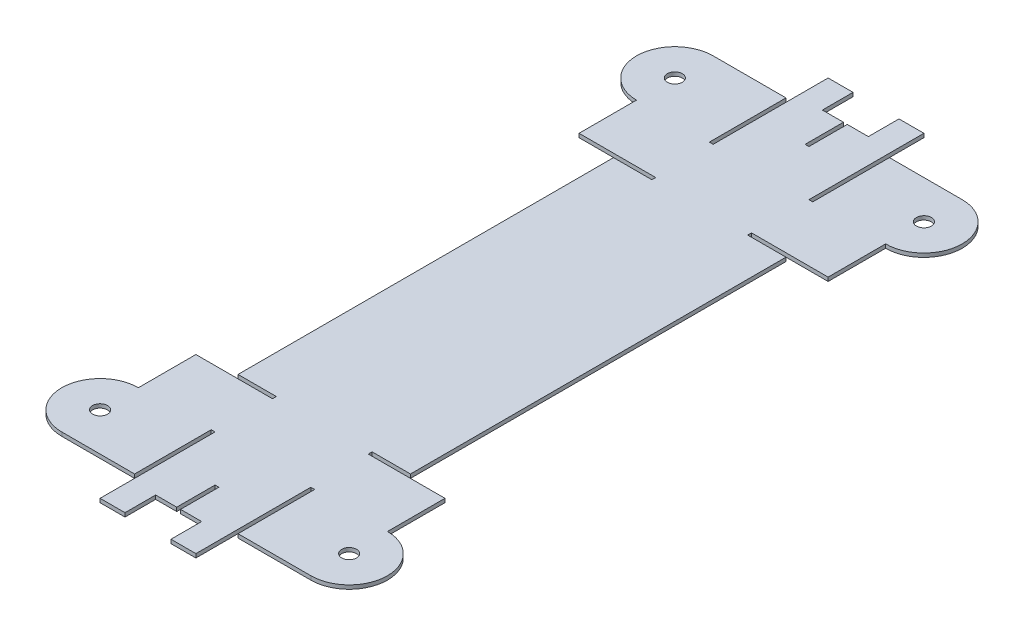
from build123d import *

# Parameters (mm, degrees)
SKETCH1_R           = 1.95
BOSS_EXTRUDE1_DEPTH = 1


with BuildPart() as part:
    # Sketch1 → Boss-Extrude1 (new body)
    with BuildSketch(Plane(origin=(0, 0, 0), x_dir=(1, 0, 0), z_dir=(0, 1, 0))):
        with BuildLine():
            Line((-32.5, 85), (-13.5, 85))
            Line((-13.5, 85), (-13.5, 65))
            Line((-13.5, 65), (-12.5, 65))
            Line((-12.5, 65), (-12.5, 95))
            Line((-12.5, 95), (-6, 95))
            Line((-6, 95), (-6, 87))
            Line((-6, 87), (-0.5, 87))
            Line((-0.5, 87), (-0.5, 77))
            Line((-0.5, 77), (0.5, 77))
            Line((0.5, 77), (0.5, 87))
            Line((0.5, 87), (6, 87))
            Line((6, 87), (6, 95))
            Line((6, 95), (12.5, 95))
            Line((12.5, 95), (12.5, 65))
            Line((12.5, 65), (13.5, 65))
            Line((13.5, 65), (13.5, 85))
            Line((13.5, 85), (32.5, 85))
            ThreePointArc((32.5, 85), (42.5, 75), (32.5, 65))
            Line((32.5, 65), (32.5, 50))
            Line((32.5, 50), (12.5, 50))
            Line((12.5, 50), (12.5, 49))
            Line((12.5, 49), (22.5, 49))
            Line((22.5, 49), (22.5, -49))
            Line((22.5, -49), (12.5, -49))
            Line((12.5, -49), (12.5, -50))
            Line((12.5, -50), (32.5, -50))
            Line((32.5, -50), (32.5, -65))
            ThreePointArc((32.5, -65), (42.5, -75), (32.5, -85))
            Line((32.5, -85), (13.5, -85))
            Line((13.5, -85), (13.5, -65))
            Line((13.5, -65), (12.5, -65))
            Line((12.5, -65), (12.5, -95))
            Line((12.5, -95), (6, -95))
            Line((6, -95), (6, -87))
            Line((6, -87), (0.5, -87))
            Line((0.5, -87), (0.5, -77))
            Line((0.5, -77), (-0.5, -77))
            Line((-0.5, -77), (-0.5, -87))
            Line((-0.5, -87), (-6, -87))
            Line((-6, -87), (-6, -95))
            Line((-6, -95), (-12.5, -95))
            Line((-12.5, -95), (-12.5, -65))
            Line((-12.5, -65), (-13.5, -65))
            Line((-13.5, -65), (-13.5, -85))
            Line((-13.5, -85), (-32.5, -85))
            ThreePointArc((-32.5, -85), (-42.5, -75), (-32.5, -65))
            Line((-32.5, -65), (-32.5, -50))
            Line((-32.5, -50), (-12.5, -50))
            Line((-12.5, -50), (-12.5, -49))
            Line((-12.5, -49), (-22.5, -49))
            Line((-22.5, -49), (-22.5, 49))
            Line((-22.5, 49), (-12.5, 49))
            Line((-12.5, 49), (-12.5, 50))
            Line((-12.5, 50), (-32.5, 50))
            Line((-32.5, 50), (-32.5, 65))
            ThreePointArc((-32.5, 65), (-42.5, 75), (-32.5, 85))
        make_face()
        with Locations((-32.5, 75)):
            Circle(SKETCH1_R, mode=Mode.SUBTRACT)
        with Locations((32.5, 75)):
            Circle(SKETCH1_R, mode=Mode.SUBTRACT)
        with Locations((32.5, -75)):
            Circle(SKETCH1_R, mode=Mode.SUBTRACT)
        with Locations((-32.5, -75)):
            Circle(SKETCH1_R, mode=Mode.SUBTRACT)
    extrude(amount=BOSS_EXTRUDE1_DEPTH)


solid = part.part
